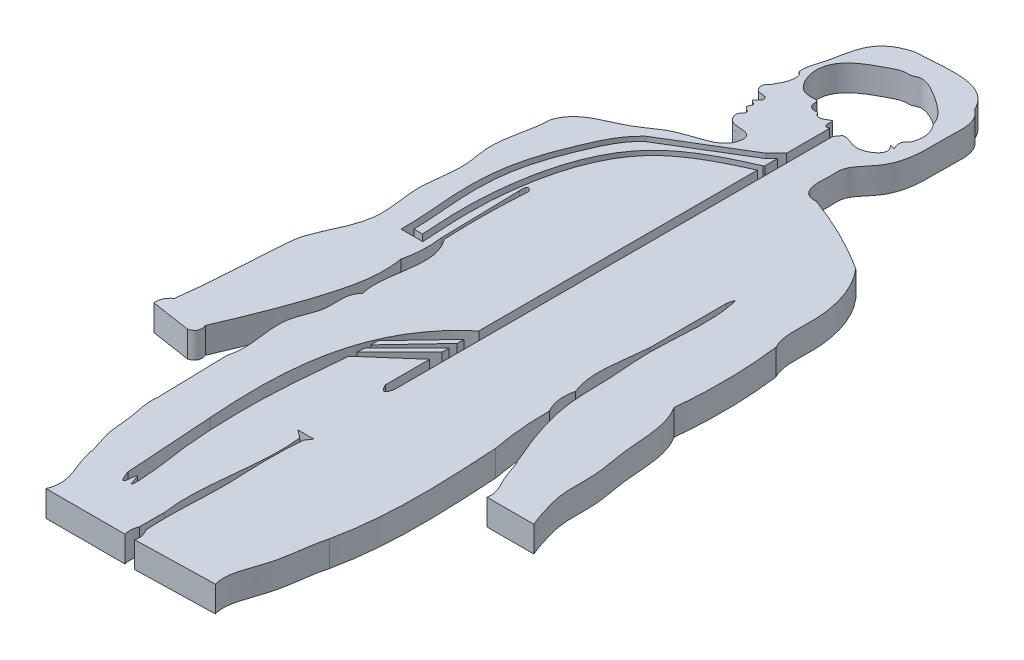
from build123d import *

# Parameters (mm, degrees)
BODY_DEPTH                       = 10
BODY_DEPTH_BACK                  = 10
BRAIN_AND_SPINAL_CORD_DEPTH      = 807.901085226
BRAIN_AND_SPINAL_CORD_DEPTH_BACK = 807.901085226
CUT_EXTRUDE_THIN6_START          = -10
CUT_EXTRUDE_THIN6_DEPTH          = 20
CUT_EXTRUDE3_DEPTH               = 807.901085226
CUT_EXTRUDE3_DEPTH_BACK          = 807.901085226
CUT_EXTRUDE4_DEPTH               = 807.901085226
CUT_EXTRUDE4_DEPTH_BACK          = 807.901085226


# Read off the part's stored shape, not the designer's step: Cut-Extrude-Thin6
with BuildPart() as part:
    # BodySketch → Body (new, two sides: drawn at the far end of the back side and taken through both)
    with BuildSketch(Plane(origin=(0, 0, 0), x_dir=(1, 0, 0), z_dir=(0, 1, 0)).offset(-BODY_DEPTH_BACK)):
        with BuildLine():
            Line((272.243265702, 104.662376343), (270.902591433, 159.779166381))
            add(Edge.make_bspline(
                [(270.902591433, 159.779166381), (275.713739927, 175.358356948), (263.803606736, 200.524537492), (281.018805877, 229.680749379), (275.122075538, 246.660982266), (281.802662038, 253.561414194)],
                knots=[0, 0, 0, 0, 0.508239746, 0.733960438, 1, 1, 1, 1], degree=3))
            add(Edge.make_bspline(
                [(281.802662038, 253.561414194), (276.040974281, 276.202432436), (293.08701698, 300.748676587), (277.140731739, 321.391303597)],
                knots=[0, 0, 0, 0, 1, 1, 1, 1], degree=3))
            add(Edge.make_bspline(
                [(277.140731739, 321.391303597), (275.58277139, 353.959035456), (277.841659489, 386.45963692)],
                knots=[0, 0, 0, 1, 1, 1], degree=2))
            add(Edge.make_bspline(
                [(277.841659489, 386.45963692), (273.180395124, 392.030076486), (273.698349789, 382.951904065)],
                knots=[0, 0, 0, 1, 1, 1], degree=2))
            Line((273.698349789, 382.951904065), (275.068379943, 321.391303597))
            add(Edge.make_bspline(
                [(275.068379943, 321.391303597), (277.180071723, 306.114568111), (273.698349789, 291.199340543)],
                knots=[0, 0, 0, 1, 1, 1], degree=2))
            add(Edge.make_bspline(
                [(273.698349789, 291.199340543), (276.917985213, 273.260926964), (267.961587734, 232.063501415), (251.958890928, 193.417782414), (242.50172402, 171.183506166)],
                knots=[0, 0, 0, 0, 0.421625729, 1, 1, 1, 1], degree=3))
            add(Edge.make_bspline(
                [(242.50172402, 171.183506166), (245.080985646, 163.916148016), (238.048742882, 161.6966151)],
                knots=[0, 0, 0, 1, 1, 1], degree=2))
            Line((238.048742882, 161.6966151), (207.213089605, 166.384421708))
            add(Edge.make_bspline(
                [(207.213089605, 166.384421708), (206.80919371, 173.042515905), (212.354795259, 177.328746161)],
                knots=[0, 0, 0, 1, 1, 1], degree=2))
            add(Edge.make_bspline(
                [(212.354795259, 177.328746161), (215.984806335, 203.633621786), (216.529846061, 232.587240229), (219.702693577, 269.747574661), (228.477093131, 286.579566968), (238.76582005, 314.021651866), (231.182611445, 339.716903543), (234.536068779, 363.868634788), (236.140750726, 381.062921406), (229.622959459, 407.851202752), (237.963258494, 427.986294263), (238.048742882, 442.511935822)],
                knots=[0, 0, 0, 0, 0.295842556, 0.324470921, 0.414095821, 0.504756758, 0.643812896, 0.696733706, 0.776624434, 0.834640906, 1, 1, 1, 1], degree=3))
            add(Edge.make_bspline(
                [(238.048742882, 442.511935822), (243.624453069, 459.733137022), (268.052181896, 463.471231245), (290.882419783, 482.586109044), (309.321464427, 487.413962935), (324.861547772, 494.485477332), (326.792828164, 508.525551856), (317.799679459, 511.005201989), (309.836454016, 509.818258764), (304.240401627, 518.938887102), (311.494750471, 524.434146835), (303.072209644, 526.826653962), (308.307613558, 531.870524418), (300.674403019, 533.994529829), (306.899820572, 536.535578088), (307.092051293, 540.110286849), (304.072209788, 542.372112768), (298.480094454, 540.62324003), (295.907818996, 548.377058402), (299.749256977, 550.99504553), (300.790137155, 554.163675843), (303.579372205, 558.164973053), (305.338602605, 564.325937977), (304.865301548, 569.579863283), (302.133527818, 571.091990636)],
                knots=[0, 0, 0, 0, 0.23534035, 0.326492577, 0.434164734, 0.517572789, 0.564521339, 0.591211598, 0.639534458, 0.680502743, 0.703750844, 0.730052427, 0.748754016, 0.768810439, 0.792311499, 0.805435436, 0.814642662, 0.843496632, 0.877033131, 0.891069268, 0.907770398, 0.924922855, 0.963131765, 1, 1, 1, 1], degree=3))
            add(Edge.make_bspline(
                [(302.133527818, 571.091990636), (301.265915828, 576.639844349), (310.321992816, 597.983593419), (307.045048818, 622.387941297), (334.444359761, 629.372900539)],
                knots=[0, 0, 0, 0, 0.233217148, 1, 1, 1, 1], degree=3))
            add(Edge.make_bspline(
                [(334.444359761, 629.372900539), (352.63048508, 629.08797069), (384.589764988, 638.277583074), (395.35902547, 613.845250564)],
                knots=[0, 0, 0, 0, 1, 1, 1, 1], degree=3))
            add(Edge.make_bspline(
                [(395.35902547, 613.845250564), (405.909185392, 606.556074519), (402.929349248, 589.972039376), (404.078778452, 564.786905973), (401.607696135, 541.263212346), (382.492011364, 526.14980354), (384.521567242, 513.74969207), (383.155914212, 501.953739601), (384.970822206, 489.704389007), (395.35902547, 491.077216811)],
                knots=[0, 0, 0, 0, 0.242123772, 0.332217247, 0.565962488, 0.732349629, 0.798246619, 0.826715145, 1, 1, 1, 1], degree=3))
            add(Edge.make_bspline(
                [(395.35902547, 491.077216811), (427.77376235, 479.359572933), (456.456820671, 460.779165357)],
                knots=[0, 0, 0, 1, 1, 1], degree=2))
            add(Edge.make_bspline(
                [(456.456820671, 460.779165357), (468.801293821, 446.37737545), (477.226765227, 416.953227213), (472.855531524, 387.293928881), (477.963536324, 377.564413354)],
                knots=[0, 0, 0, 0, 0.638596623, 1, 1, 1, 1], degree=3))
            add(Edge.make_bspline(
                [(477.963536324, 377.564413354), (483.0700862, 337.748578236), (478.911107868, 297.650996412)],
                knots=[0, 0, 0, 1, 1, 1], degree=2))
            add(Edge.make_bspline(
                [(478.911107868, 297.650996412), (488.911008175, 282.039510417), (486.699359452, 255.771777789), (494.757080963, 221.539688484), (492.14290699, 198.039734086), (498.000293429, 178.685499411), (501.166438128, 168.952674658), (503.026990934, 164.975672307)],
                knots=[0, 0, 0, 0, 0.393463614, 0.55747543, 0.774065271, 0.903097631, 1, 1, 1, 1], degree=3))
            Line((503.026990934, 164.975672307), (466.612349499, 164.975672307))
            add(Edge.make_bspline(
                [(466.612349499, 164.975672307), (468.263448953, 172.496836788), (459.680941572, 182.771643402), (456.980894407, 196.455900874), (454.312550708, 200.871507723)],
                knots=[0, 0, 0, 0, 0.552483549, 1, 1, 1, 1], degree=3))
            add(Edge.make_bspline(
                [(454.312550708, 200.871507723), (446.287703558, 219.634278536), (433.900943954, 250.005617921), (435.170389229, 291.46536058), (430.070188606, 334.247572489), (436.621893178, 366.232536276), (432.077895195, 388.57765049)],
                knots=[0, 0, 0, 0, 0.324255369, 0.4985874, 0.647594043, 1, 1, 1, 1], degree=3))
            add(Edge.make_bspline(
                [(432.077895195, 388.57765049), (431.030065034, 397.529157713), (429.456038232, 387.13835084)],
                knots=[0, 0, 0, 1, 1, 1], degree=2))
            Line((429.456038232, 387.13835084), (429.456038232, 328.052597674))
            add(Edge.make_bspline(
                [(429.456038232, 328.052597674), (428.044812736, 309.413440059), (422.246097634, 288.499096911), (430.009451171, 270.339159268)],
                knots=[0, 0, 0, 0, 1, 1, 1, 1], degree=3))
            add(Edge.make_bspline(
                [(433.071569777, 246.946305329), (426.898065019, 257.708717735), (430.009451171, 270.339159268)],
                knots=[0, 0, 0, 1, 1, 1], degree=2))
            add(Edge.make_bspline(
                [(437.247009547, 200.871507723), (432.886233952, 223.758807082), (433.071569777, 246.946305329)],
                knots=[0, 0, 0, 1, 1, 1], degree=2))
            add(Edge.make_bspline(
                [(433.579736795, 76.082639039), (442.155347252, 117.073754857), (439.736872549, 159.384901051), (437.247009547, 200.871507723)],
                knots=[0, 0, 0, 0, 1, 1, 1, 1], degree=3))
            add(Edge.make_bspline(
                [(419.795273297, 1.487219066), (417.227062484, 11.185109191), (422.100164293, 24.2912361), (429.861397996, 48.494344019), (430.36914776, 64.867735856), (433.579736795, 76.082639039)],
                knots=[0, 0, 0, 0, 0.369658387, 0.540270457, 1, 1, 1, 1], degree=3))
            Line((419.795273297, 1.487219066), (358.653844009, 0))
            add(Edge.make_bspline(
                [(356.666983063, 10.564832911), (360.1763808, 5.861937825), (358.653844009, 0)],
                knots=[0, 0, 0, 1, 1, 1], degree=2))
            add(Edge.make_bspline(
                [(356.666983063, 88.509051042), (358.791625824, 62.546820399), (354.537237712, 36.538565503), (356.666983063, 10.564832911)],
                knots=[0, 0, 0, 0, 1, 1, 1, 1], degree=3))
            add(Edge.make_bspline(
                [(357.383825046, 132.220771362), (355.605364948, 110.977156542), (356.666983063, 88.509051042)],
                knots=[0, 0, 0, 1, 1, 1], degree=2))
            Line((357.383825046, 132.220771362), (360.695702592, 136.90590743))
            Line((360.695702592, 136.90590743), (348.309275301, 136.90590743))
            Line((348.309275301, 136.90590743), (354.443772912, 132.220771362))
            add(Edge.make_bspline(
                [(351.956883427, 30.173646058), (347.086943595, 64.463901325), (358.594375749, 97.893141247), (354.443772912, 132.220771362)],
                knots=[0, 0, 0, 0, 1, 1, 1, 1], degree=3))
            Line((351.956883427, 30.173646058), (351.956883427, 10.564832911))
            add(Edge.make_bspline(
                [(351.341187763, 0), (349.767516102, 5.46159279), (351.956883427, 10.564832911)],
                knots=[0, 0, 0, 1, 1, 1], degree=2))
            Line((351.341187763, 0), (290.141641791, 0))
            add(Edge.make_bspline(
                [(290.141641791, 0), (295.840940806, 13.602326271), (285.106946909, 27.258119388), (281.852102956, 47.992352342), (275.903398482, 61.49980619), (275.915737219, 81.680558561), (271.096420433, 95.894783519), (272.243265702, 104.662376343)],
                knots=[0, 0, 0, 0, 0.352062338, 0.443917182, 0.585726882, 0.759119028, 1, 1, 1, 1], degree=3))
        make_face()
    extrude(amount=BODY_DEPTH + BODY_DEPTH_BACK)

    # BodySketch<13> → Brain And Spinal Cord (cut, two sides: drawn at the far end of the back side and taken through both)
    with BuildSketch(Plane(origin=(0, 0, 0), x_dir=(1, 0, 0), z_dir=(0, 1, 0)).offset(-BRAIN_AND_SPINAL_CORD_DEPTH_BACK)):
        with BuildLine():
            Line((352.000872736, 545.051082045), (352.000872736, 200.871507723))
            add(Edge.make_bspline(
                [(352.000872736, 200.871507723), (356.658375061, 191.262541297), (358.61330368, 201.535416749)],
                knots=[0, 0, 0, 1, 1, 1], degree=2))
            Line((358.61330368, 201.535416749), (358.61330368, 540.724163711))
            Line((358.61330368, 540.724163711), (361.69916343, 545.051082045))
            add(Edge.make_bspline(
                [(361.69916343, 545.051082045), (365.118564541, 546.130688018), (371.875900961, 541.488228835), (383.434314076, 542.744041592), (392.872989638, 552.865074529), (384.747643338, 558.989155482), (390.725273119, 556.058950887)],
                knots=[0, 0, 0, 0, 0.239252415, 0.569098769, 0.823798548, 1, 1, 1, 1], degree=3))
            add(Edge.make_bspline(
                [(390.725273119, 556.058950887), (386.922847997, 563.768590341), (392.393389673, 566.882904615)],
                knots=[0, 0, 0, 1, 1, 1], degree=2))
            add(Edge.make_bspline(
                [(392.393389673, 566.882904615), (397.197113124, 578.364692794), (389.140185583, 588.257792823)],
                knots=[0, 0, 0, 1, 1, 1], degree=2))
            add(Edge.make_bspline(
                [(352.000872736, 545.051082045), (346.110835065, 542.914702771), (351.213219723, 554.519212296), (343.413223739, 548.178769943), (338.537133243, 547.658677535), (336.756437315, 551.438843267), (333.050807015, 550.636558854), (328.450158826, 552.962137325), (329.757265516, 558.931212407), (324.376869357, 558.944919625), (316.31126059, 558.316839694), (307.089521643, 570.84733762), (307.498419081, 594.587938548), (327.920043028, 605.14202831), (342.35115034, 612.315295667), (348.392297141, 611.526118641), (352.229366724, 614.174141889), (359.055358758, 613.772134686), (368.085669971, 609.107203849), (379.960867492, 601.255454633), (387.628599906, 593.768295373), (389.140185583, 588.257792823)],
                knots=[0, 0, 0, 0, 0.048494003, 0.078938025, 0.108331572, 0.125975253, 0.136002324, 0.169057391, 0.195658355, 0.209878392, 0.248039824, 0.339004399, 0.429358756, 0.632881338, 0.676462683, 0.705180566, 0.732962908, 0.751987016, 0.819901363, 0.905132064, 1, 1, 1, 1], degree=3))
        make_face()
    extrude(amount=BRAIN_AND_SPINAL_CORD_DEPTH + BRAIN_AND_SPINAL_CORD_DEPTH_BACK, mode=Mode.SUBTRACT)

    # Cut-Extrude-Thin6 outline → Cut-Extrude-Thin6 (cut)
    with BuildSketch(Plane(origin=(0, 0, 0), x_dir=(1, 0, 0), z_dir=(0, 1, 0)).offset(CUT_EXTRUDE_THIN6_START)):
        with BuildLine():
            Line((253.59295826, 311.5), (270.405234995, 311.5))
            add(Edge.make_bspline(
                [(270.405234995, 311.5), (270.285725151, 315.97480839), (269.996681351, 320.456775036), (269.561004924, 327.179814126), (269.415608837, 329.420834359), (269.169405037, 333.900992166), (269.068361461, 336.140139698), (268.680903932, 347.330905145), (268.749518165, 356.267532657), (269.81056917, 374.101780998), (270.803121354, 382.999396954), (272.692237646, 394.094038318), (273.102825064, 396.311583185), (273.998017049, 400.743547684), (274.483358556, 402.96062554), (276.054289061, 409.561992189), (277.256087971, 413.908574094), (280.041348241, 422.46753845), (281.624236076, 426.680122562), (284.361870125, 432.871255041), (285.335254147, 434.91357365), (286.899886242, 437.940287752), (287.439490096, 438.943995222), (288.548062816, 440.924142349), (289.117830233, 441.902209059), (292.047346791, 446.729968938), (294.648033325, 450.392795026), (299.009815183, 455.529682438), (300.543002097, 457.180505778), (302.959054664, 459.566561983), (303.783347363, 460.34722307), (305.467786004, 461.880738057), (306.326631732, 462.632279938), (310.66680293, 466.293739893), (314.312663312, 468.944134802), (321.843127509, 473.861814297), (325.728528578, 476.127819534), (333.661796948, 480.399121308), (337.711490374, 482.40426634), (343.855191926, 485.292206394), (345.912586355, 486.233859542), (349.315373181, 487.763514779), (350.657412322, 488.358931798), (352.000872736, 488.951206011)],
                knots=[0, 0, 0, 0, 0.0625, 0.0625, 0.09375, 0.09375, 0.125, 0.125, 0.25, 0.25, 0.375, 0.375, 0.40625, 0.40625, 0.4375, 0.4375, 0.5, 0.5, 0.5625, 0.5625, 0.59375, 0.59375, 0.609375, 0.609375, 0.625, 0.625, 0.6875, 0.6875, 0.71875, 0.71875, 0.734375, 0.734375, 0.75, 0.75, 0.8125, 0.8125, 0.875, 0.875, 0.9375, 0.9375, 0.96875, 0.96875, 0.98902726, 0.98902726, 0.98902726, 0.98902726], degree=3))
            Line((352.000872736, 488.951206011), (352.000872736, 494.799566292))
            Line((352.000872736, 494.799566292), (351.31257331, 494.111266866))
            add(Edge.make_bspline(
                [(265.203861704, 316.49999999), (264.955118142, 321.424082633), (263.037645129, 346.508546567), (264.634030562, 395.545011947), (286.565004119, 464.012713374), (331.897141908, 485.59351132), (351.31257331, 494.111266866)],
                knots=[0.416646882, 0.416646882, 0.416646882, 0.416646882, 0.45670879, 0.620396999, 0.821298513, 1, 1, 1, 1], degree=3))
            Line((265.203861704, 316.49999999), (258.601532425, 316.5))
            add(Edge.make_bspline(
                [(289.094934675, 464.536995472), (280.813121114, 456.874574854), (269.933124396, 433.743827148), (257.102564433, 398.893535812), (254.701404635, 358.376823101), (258.397438578, 331.301278334), (258.601532425, 316.5)],
                knots=[0, 0, 0, 0, 0.163462592, 0.37404238, 0.543538074, 0.761456211, 0.761456211, 0.761456211, 0.761456211], degree=3))
            Line((289.094934675, 464.536995472), (347.096728366, 499.735278392))
            Line((347.096728366, 499.735278392), (352.000872736, 504.639422762))
            Line((352.000872736, 504.639422762), (352.000872736, 511.710490574))
            Line((352.000872736, 511.710490574), (343.987432271, 503.697050109))
            Line((343.987432271, 503.697050109), (286.069643571, 468.549745465))
            add(Edge.make_bspline(
                [(286.069643571, 468.549745465), (285.749804962, 468.253827435), (285.429528652, 467.958214989), (284.801354623, 467.358347876), (283.873013897, 466.448828616), (282.985169755, 465.51103631), (281.260129118, 463.600091601), (280.177640146, 462.278976132), (277.105986582, 458.192884092), (275.293067919, 455.304859882), (272.814018347, 450.805036174), (272.027630285, 449.27719526), (270.89294864, 446.954086249), (270.521927494, 446.17389499), (269.794824972, 444.610591914), (269.438428036, 443.826866575), (268.385796613, 441.470890543), (267.706110176, 439.893843121), (266.365236735, 436.734385906), (265.704463947, 435.151856046), (262.461151651, 427.221654838), (260.0598666, 420.821443852), (255.959902453, 407.81735978), (254.263104724, 401.212941348), (252.491271698, 391.082141324), (252.02444234, 387.669327799), (251.496426944, 382.500184157), (251.34902207, 380.767409849), (251.109646774, 377.291992619), (251.018021107, 375.555245558), (250.821235559, 370.347680203), (250.794073609, 366.879534536), (250.917850734, 359.949345893), (251.072429082, 356.487427618), (251.696363801, 346.10716209), (252.32402308, 339.194239139), (253.081280529, 328.81854196), (253.302831837, 325.358918536), (253.590919576, 318.434360052), (253.657754585, 314.969435222), (253.59295826, 311.5)],
                knots=[0, 0, 0, 0, 0.0078125, 0.0078125, 0.015625, 0.03125, 0.03125, 0.0625, 0.0625, 0.125, 0.125, 0.15625, 0.15625, 0.171875, 0.171875, 0.1875, 0.1875, 0.21875, 0.21875, 0.25, 0.25, 0.375, 0.375, 0.5, 0.5, 0.5625, 0.5625, 0.59375, 0.59375, 0.625, 0.625, 0.6875, 0.6875, 0.75, 0.75, 0.875, 0.875, 0.9375, 0.9375, 1, 1, 1, 1], degree=3))
        make_face()
    extrude(amount=CUT_EXTRUDE_THIN6_DEPTH, mode=Mode.SUBTRACT)

    # BodySketch<34> → Cut-Extrude3 (cut, two sides: drawn at the far end of the back side and taken through both)
    with BuildSketch(Plane(origin=(0, 0, 0), x_dir=(1, 0, 0), z_dir=(0, 1, 0)).offset(-CUT_EXTRUDE3_DEPTH_BACK)):
        with BuildLine():
            Line((352.000872736, 261.983767712), (352.000872736, 273.293147267))
            add(Edge.make_bspline(
                [(306.093050924, 110.948547986), (301.998499048, 167.425973203), (302.452904761, 232.168121991), (352.000872736, 273.293147267)],
                knots=[0, 0, 0, 0, 1, 1, 1, 1], degree=3))
            add(Edge.make_bspline(
                [(310.683091688, 42.798736469), (308.708159857, 73.88143262), (306.093050924, 110.948547986)],
                knots=[0, 0, 0, 1, 1, 1], degree=2))
            add(Edge.make_bspline(
                [(318.613340543, 205.963251564), (316.815331226, 187.145293021), (314.09250426, 159.485787613), (313.462890118, 116.370308577), (315.479832249, 80.490653116), (319.498309105, 60.556845936), (322.083163081, 26.578674069), (314.843084828, 53.792080378), (316.956674489, 25.209426473), (310.683091688, 42.798736469)],
                knots=[0, 0, 0, 0, 0.298114863, 0.428128118, 0.691813755, 0.786865449, 0.884716032, 0.923778008, 1, 1, 1, 1], degree=3))
            Line((318.613340543, 205.963251564), (318.965059404, 211.834209884))
            Line((318.965059404, 211.834209884), (319.307134067, 217.544185414))
            Line((319.307134067, 217.544185414), (319.583376979, 222.155284796))
            Line((319.583376979, 222.155284796), (319.583376979, 227.795204548))
            Line((319.583376979, 227.795204548), (352.000872736, 261.983767712))
        make_face()
    extrude(amount=CUT_EXTRUDE3_DEPTH + CUT_EXTRUDE3_DEPTH_BACK, mode=Mode.SUBTRACT)

    # BodySketch<35> → Cut-Extrude4 (cut, two sides: drawn at the far end of the back side and taken through both)
    with BuildSketch(Plane(origin=(0, 0, 0), x_dir=(1, 0, 0), z_dir=(0, 1, 0)).offset(-CUT_EXTRUDE4_DEPTH_BACK)):
        Polygon((318.965059404, 211.834209884), (318.613340543, 205.963251564), (352.000872736, 235.284690711), (352.000872736, 244.870023216), align=None)
        Polygon((352.000872736, 250.237924083), (352.000872736, 256.567914629), (319.583376979, 222.155284796), (319.307134067, 217.544185414), align=None)
    extrude(amount=CUT_EXTRUDE4_DEPTH + CUT_EXTRUDE4_DEPTH_BACK, mode=Mode.SUBTRACT)


solid = part.part
